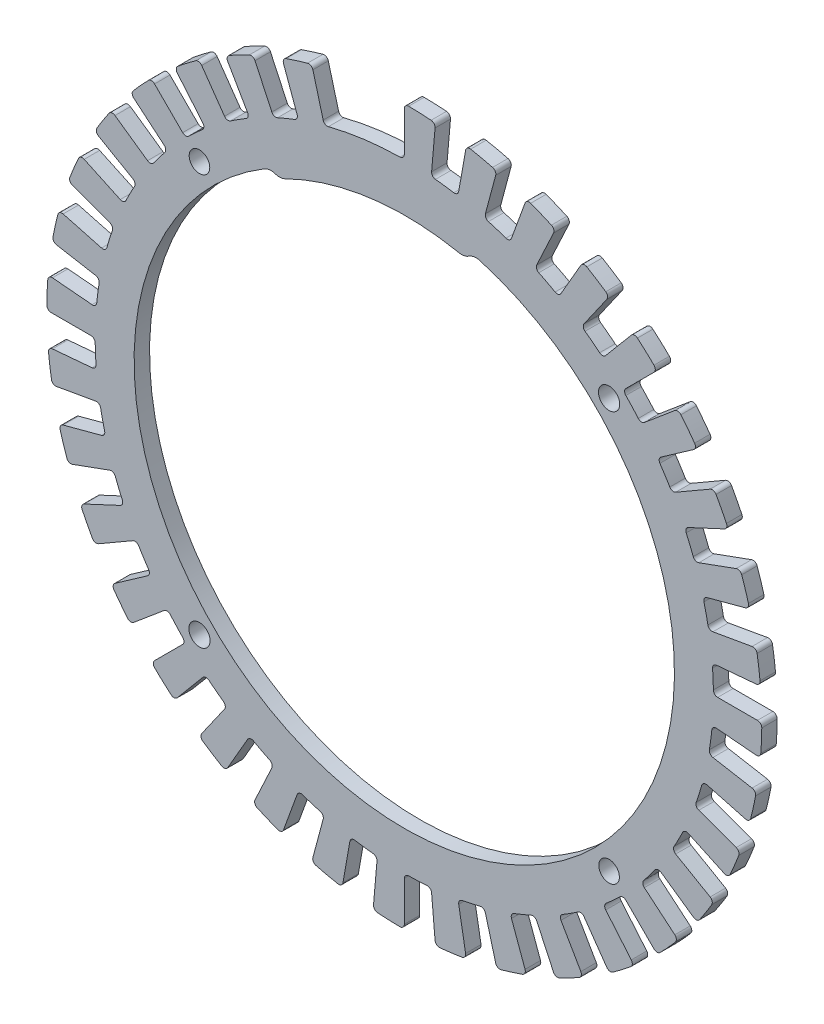
from build123d import *

# Parameters (mm, degrees)
SKETCH1_R           = 2.4585
SKETCH1_R_2         = 2.38125
BOSS_EXTRUDE1_DEPTH = 3.571875


with BuildPart() as part:
    # Sketch1 → Boss-Extrude1 (new body)
    with BuildSketch(Plane.XY):
        with BuildLine():
            Line((7.120090774, 81.383009943), (6.318190247, 72.217244977))
            ThreePointArc((6.318190247, 72.217244977), (6.543925597, 71.492600102), (7.213496876, 71.135191451))
            ThreePointArc((7.213496876, 71.135191451), (9.332622744, 70.888307588), (11.443439394, 70.578308954))
            ThreePointArc((11.443439394, 70.578308954), (12.182699751, 70.750241401), (12.58829525, 71.391769993))
            Line((12.58829525, 71.391769993), (14.185993357, 80.45276622))
            ThreePointArc((14.185993357, 80.45276622), (14.60224868, 81.101765071), (15.35649023, 81.261726586))
            ThreePointArc((15.35649023, 81.261726586), (17.899556073, 80.739679789), (20.424982959, 80.138068801))
            ThreePointArc((20.424982959, 80.138068801), (21.040955292, 79.674338181), (21.143931966, 78.910228368))
            Line((21.143931966, 78.910228368), (18.762595726, 70.022960532))
            ThreePointArc((18.762595726, 70.022960532), (18.859068387, 69.270126109), (19.456404014, 68.801877466))
            ThreePointArc((19.456404014, 68.801877466), (21.500464665, 68.190761978), (23.525382569, 67.518933456))
            ThreePointArc((23.525382569, 67.518933456), (24.283267656, 67.559882649), (24.794101519, 68.12123406))
            Line((24.794101519, 68.12123406), (27.940952485, 76.76713603))
            ThreePointArc((27.940952485, 76.76713603), (28.463581422, 77.333993152), (29.234141374, 77.360551822))
            ThreePointArc((29.234141374, 77.360551822), (31.647919857, 76.404837339), (34.030511182, 75.373830397))
            ThreePointArc((34.030511182, 75.373830397), (34.556599534, 74.810182414), (34.525325484, 74.039799434))
            Line((34.525325484, 74.039799434), (30.636909229, 65.701063864))
            ThreePointArc((30.636909229, 65.701063864), (30.601187928, 64.942914386), (31.108138161, 64.378053249))
            ThreePointArc((31.108138161, 64.378053249), (33.015025846, 63.421274572), (34.892518899, 62.40802933))
            ThreePointArc((34.892518899, 62.40802933), (35.646000762, 62.316751049), (36.24655156, 62.780868901))
            Line((36.24655156, 62.780868901), (40.84693991, 70.748975258))
            ThreePointArc((40.84693991, 70.748975258), (41.460062645, 71.216466984), (42.223527925, 71.108815836))
            ThreePointArc((42.223527925, 71.108815836), (44.43467761, 69.748472569), (46.602039543, 68.319396297))
            ThreePointArc((46.602039543, 68.319396297), (47.022258986, 67.67295711), (46.857684459, 66.91970866))
            Line((46.857684459, 66.91970866), (41.580335748, 59.382873618))
            ThreePointArc((41.580335748, 59.382873618), (41.413505858, 58.642445073), (41.814667271, 57.998134462))
            ThreePointArc((41.814667271, 57.998134462), (43.526442174, 56.724763831), (45.199463699, 55.400888814))
            ThreePointArc((45.199463699, 55.400888814), (45.925648172, 55.180156502), (46.597668473, 55.53293881))
            Line((46.597668473, 55.53293881), (52.511813735, 62.581142673))
            ThreePointArc((52.511813735, 62.581142673), (53.196800845, 62.935064503), (53.929973946, 62.696474464))
            ThreePointArc((53.929973946, 62.696474464), (55.87131017, 60.972835754), (57.757588515, 59.189111912))
            ThreePointArc((57.757588515, 59.189111912), (58.059170893, 58.479523249), (57.766296402, 57.766296402))
            Line((57.766296402, 57.766296402), (51.260364806, 51.260364806))
            ThreePointArc((51.260364806, 51.260364806), (50.967495369, 50.56015474), (51.250678875, 49.855971707))
            ThreePointArc((51.250678875, 49.855971707), (52.715329582, 48.304699845), (54.133045666, 46.710420325))
            ThreePointArc((54.133045666, 46.710420325), (54.809868002, 46.366940822), (55.53293881, 46.597668473))
            Line((55.53293881, 46.597668473), (62.581142673, 52.511813735))
            ThreePointArc((62.581142673, 52.511813735), (63.31718117, 52.741411935), (63.997784998, 52.379132441))
            ThreePointArc((63.997784998, 52.379132441), (65.610321242, 50.344570179), (67.158202386, 48.260396313))
            ThreePointArc((67.158202386, 48.260396313), (67.331984272, 47.509218665), (66.91970866, 46.857684459))
            Line((66.91970866, 46.857684459), (59.382873618, 41.580335748))
            ThreePointArc((59.382873618, 41.580335748), (58.972863325, 40.94161969), (59.129464536, 40.19896048))
            ThreePointArc((59.129464536, 40.19896048), (60.302488376, 38.416921997), (61.421822434, 36.600679351))
            ThreePointArc((61.421822434, 36.600679351), (62.028717727, 36.144889108), (62.780868901, 36.24655156))
            Line((62.780868901, 36.24655156), (70.748975258, 40.84693991))
            ThreePointArc((70.748975258, 40.84693991), (71.513700985, 40.945238253), (72.121055738, 40.470276985))
            ThreePointArc((72.121055738, 40.470276985), (73.355795904, 38.186610315), (74.518248261, 35.865312993))
            ThreePointArc((74.518248261, 35.865312993), (74.55894938, 35.095370514), (74.039799434, 34.525325484))
            Line((74.039799434, 34.525325484), (65.701063864, 30.636909229))
            ThreePointArc((65.701063864, 30.636909229), (65.186370669, 30.079094244), (65.211631338, 29.320524181))
            ThreePointArc((65.211631338, 29.320524181), (66.057386575, 27.361865414), (66.844328207, 25.378845255))
            ThreePointArc((66.844328207, 25.378845255), (67.362856253, 24.824593229), (68.12123406, 24.794101519))
            Line((68.12123406, 24.794101519), (76.76713603, 27.940952485))
            ThreePointArc((76.76713603, 27.940952485), (77.537313183, 27.904964226), (78.052964694, 27.331752641))
            ThreePointArc((78.052964694, 27.331752641), (78.872391827, 24.868369619), (79.614094871, 22.380480286))
            ThreePointArc((79.614094871, 22.380480286), (79.52047854, 21.615167288), (78.910228368, 21.143931966))
            Line((78.910228368, 21.143931966), (70.022960532, 18.762595726))
            ThreePointArc((70.022960532, 18.762595726), (69.419223127, 18.30263074), (69.312375721, 17.551198591))
            ThreePointArc((69.312375721, 17.551198591), (69.805164509, 15.475432397), (70.235802893, 13.385887789))
            ThreePointArc((70.235802893, 13.385887789), (70.650208479, 12.750014647), (71.391769993, 12.58829525))
            Line((71.391769993, 12.58829525), (80.45276622, 14.185993357))
            ThreePointArc((80.45276622, 14.185993357), (81.204993357, 14.016811982), (81.613273815, 13.362766823))
            ThreePointArc((81.613273815, 13.362766823), (81.992490036, 10.794516097), (82.290907495, 8.215628011))
            ThreePointArc((82.290907495, 8.215628011), (82.065818199, 7.478198142), (81.383009943, 7.120090774))
            Line((81.383009943, 7.120090774), (72.217244977, 6.318190247))
            ThreePointArc((72.217244977, 6.318190247), (71.542807618, 5.970051062), (71.30709864, 5.248588713))
            ThreePointArc((71.30709864, 5.248588713), (71.431947843, 3.118786197), (71.49319825, 0.986206897))
            ThreePointArc((71.49319825, 0.986206897), (71.79088987, 0.288033321), (72.49310312, 0))
            Line((72.49310312, 0), (81.69387982, 0))
            ThreePointArc((81.69387982, 0), (82.405300898, -0.297234001), (82.693804909, -1.012239902))
            ThreePointArc((82.693804909, -1.012239902), (82.621287925, -3.607323335), (82.467352536, -6.198851964))
            ThreePointArc((82.467352536, -6.198851964), (82.1176295, -6.88599227), (81.383009943, -7.120090774))
            Line((81.383009943, -7.120090774), (72.217244977, -6.318190247))
            ThreePointArc((72.217244977, -6.318190247), (71.492600102, -6.543925597), (71.135191451, -7.213496876))
            ThreePointArc((71.135191451, -7.213496876), (70.888307588, -9.332622744), (70.578308954, -11.443439394))
            ThreePointArc((70.578308954, -11.443439394), (70.750241401, -12.182699751), (71.391769993, -12.58829525))
            Line((71.391769993, -12.58829525), (80.45276622, -14.185993357))
            ThreePointArc((80.45276622, -14.185993357), (81.101765071, -14.60224868), (81.261726586, -15.35649023))
            ThreePointArc((81.261726586, -15.35649023), (80.739679789, -17.899556073), (80.138068801, -20.424982959))
            ThreePointArc((80.138068801, -20.424982959), (79.674338181, -21.040955292), (78.910228368, -21.143931966))
            Line((78.910228368, -21.143931966), (70.022960532, -18.762595726))
            ThreePointArc((70.022960532, -18.762595726), (69.270126109, -18.859068387), (68.801877466, -19.456404014))
            ThreePointArc((68.801877466, -19.456404014), (68.190761979, -21.500464665), (67.518933456, -23.525382569))
            ThreePointArc((67.518933456, -23.525382569), (67.559882649, -24.283267656), (68.12123406, -24.794101519))
            Line((68.12123406, -24.794101519), (76.76713603, -27.940952485))
            ThreePointArc((76.76713603, -27.940952485), (77.333993152, -28.463581422), (77.360551822, -29.234141374))
            ThreePointArc((77.360551822, -29.234141374), (76.404837339, -31.647919857), (75.373830397, -34.030511182))
            ThreePointArc((75.373830397, -34.030511182), (74.810182414, -34.556599534), (74.039799434, -34.525325484))
            Line((74.039799434, -34.525325484), (65.701063864, -30.636909229))
            ThreePointArc((65.701063864, -30.636909229), (64.942914386, -30.601187928), (64.378053249, -31.10813816))
            ThreePointArc((64.378053249, -31.10813816), (63.421274572, -33.015025846), (62.40802933, -34.892518899))
            ThreePointArc((62.40802933, -34.892518899), (62.316751049, -35.646000762), (62.780868901, -36.24655156))
            Line((62.780868901, -36.24655156), (70.748975258, -40.84693991))
            ThreePointArc((70.748975258, -40.84693991), (71.216466984, -41.460062645), (71.108815836, -42.223527925))
            ThreePointArc((71.108815836, -42.223527925), (69.748472569, -44.43467761), (68.319396297, -46.602039543))
            ThreePointArc((68.319396297, -46.602039543), (67.67295711, -47.022258986), (66.91970866, -46.857684459))
            Line((66.91970866, -46.857684459), (59.382873618, -41.580335748))
            ThreePointArc((59.382873618, -41.580335748), (58.642445073, -41.413505858), (57.998134462, -41.814667271))
            ThreePointArc((57.998134462, -41.814667271), (56.724763831, -43.526442174), (55.400888814, -45.199463699))
            ThreePointArc((55.400888814, -45.199463699), (55.180156502, -45.925648172), (55.53293881, -46.597668473))
            Line((55.53293881, -46.597668473), (62.581142673, -52.511813735))
            ThreePointArc((62.581142673, -52.511813735), (62.935064503, -53.196800845), (62.696474464, -53.929973946))
            ThreePointArc((62.696474464, -53.929973946), (60.972835754, -55.87131017), (59.189111912, -57.757588515))
            ThreePointArc((59.189111912, -57.757588515), (58.479523249, -58.059170893), (57.766296402, -57.766296402))
            Line((57.766296402, -57.766296402), (51.260364806, -51.260364806))
            ThreePointArc((51.260364806, -51.260364806), (50.56015474, -50.967495369), (49.855971707, -51.250678875))
            ThreePointArc((49.855971707, -51.250678875), (48.304699845, -52.715329582), (46.710420325, -54.133045666))
            ThreePointArc((46.710420325, -54.133045666), (46.366940822, -54.809868002), (46.597668473, -55.53293881))
            Line((46.597668473, -55.53293881), (52.511813735, -62.581142673))
            ThreePointArc((52.511813735, -62.581142673), (52.741411935, -63.31718117), (52.379132441, -63.997784998))
            ThreePointArc((52.379132441, -63.997784998), (50.344570179, -65.610321242), (48.260396313, -67.158202386))
            ThreePointArc((48.260396313, -67.158202386), (47.509218665, -67.331984272), (46.857684459, -66.91970866))
            Line((46.857684459, -66.91970866), (41.580335748, -59.382873618))
            ThreePointArc((41.580335748, -59.382873618), (40.94161969, -58.972863325), (40.19896048, -59.129464536))
            ThreePointArc((40.19896048, -59.129464536), (38.416921997, -60.302488376), (36.600679351, -61.421822434))
            ThreePointArc((36.600679351, -61.421822434), (36.144889108, -62.028717727), (36.24655156, -62.780868901))
            Line((36.24655156, -62.780868901), (40.84693991, -70.748975258))
            ThreePointArc((40.84693991, -70.748975258), (40.945238253, -71.513700985), (40.470276985, -72.121055738))
            ThreePointArc((40.470276985, -72.121055738), (38.186610315, -73.355795904), (35.865312993, -74.518248261))
            ThreePointArc((35.865312993, -74.518248261), (35.095370514, -74.55894938), (34.525325484, -74.039799434))
            Line((34.525325484, -74.039799434), (30.636909229, -65.701063864))
            ThreePointArc((30.636909229, -65.701063864), (30.079094244, -65.186370669), (29.320524181, -65.211631338))
            ThreePointArc((29.320524181, -65.211631338), (27.361865414, -66.057386575), (25.378845255, -66.844328207))
            ThreePointArc((25.378845255, -66.844328207), (24.824593229, -67.362856253), (24.794101519, -68.12123406))
            Line((24.794101519, -68.12123406), (27.940952485, -76.76713603))
            ThreePointArc((27.940952485, -76.76713603), (27.904964226, -77.537313183), (27.331752641, -78.052964694))
            ThreePointArc((27.331752641, -78.052964694), (24.868369619, -78.872391827), (22.380480286, -79.614094871))
            ThreePointArc((22.380480286, -79.614094871), (21.615167288, -79.52047854), (21.143931966, -78.910228368))
            Line((21.143931966, -78.910228368), (18.762595726, -70.022960532))
            ThreePointArc((18.762595726, -70.022960532), (18.30263074, -69.419223127), (17.551198591, -69.312375721))
            ThreePointArc((17.551198591, -69.312375721), (15.475432397, -69.805164509), (13.385887789, -70.235802893))
            ThreePointArc((13.385887789, -70.235802893), (12.750014647, -70.650208479), (12.58829525, -71.391769993))
            Line((12.58829525, -71.391769993), (14.185993357, -80.45276622))
            ThreePointArc((14.185993357, -80.45276622), (14.016811982, -81.204993357), (13.362766823, -81.613273815))
            ThreePointArc((13.362766823, -81.613273815), (10.794516097, -81.992490036), (8.215628011, -82.290907495))
            ThreePointArc((8.215628011, -82.290907495), (7.478198142, -82.065818199), (7.120090774, -81.383009943))
            Line((7.120090774, -81.383009943), (6.318190247, -72.217244977))
            ThreePointArc((6.318190247, -72.217244977), (5.970051062, -71.542807618), (5.248588713, -71.30709864))
            ThreePointArc((5.248588713, -71.30709864), (3.118786197, -71.431947843), (0.986206897, -71.49319825))
            ThreePointArc((0.986206897, -71.49319825), (0.288033321, -71.79088987), (0, -72.49310312))
            Line((0, -72.49310312), (0, -81.69387982))
            ThreePointArc((0, -81.69387982), (-0.297234001, -82.405300898), (-1.012239902, -82.693804909))
            ThreePointArc((-1.012239902, -82.693804909), (-3.607323335, -82.621287925), (-6.198851964, -82.467352536))
            ThreePointArc((-6.198851964, -82.467352536), (-6.88599227, -82.1176295), (-7.120090774, -81.383009943))
            Line((-7.120090774, -81.383009943), (-6.318190247, -72.217244977))
            ThreePointArc((-6.318190247, -72.217244977), (-6.543925597, -71.492600102), (-7.213496876, -71.135191451))
            ThreePointArc((-7.213496876, -71.135191451), (-9.332622744, -70.888307588), (-11.443439394, -70.578308954))
            ThreePointArc((-11.443439394, -70.578308954), (-12.182699751, -70.750241401), (-12.58829525, -71.391769993))
            Line((-12.58829525, -71.391769993), (-14.185993357, -80.45276622))
            ThreePointArc((-14.185993357, -80.45276622), (-14.60224868, -81.101765071), (-15.35649023, -81.261726586))
            ThreePointArc((-15.35649023, -81.261726586), (-17.899556073, -80.739679789), (-20.424982959, -80.138068801))
            ThreePointArc((-20.424982959, -80.138068801), (-21.040955292, -79.674338181), (-21.143931966, -78.910228368))
            Line((-21.143931966, -78.910228368), (-18.762595726, -70.022960532))
            ThreePointArc((-18.762595726, -70.022960532), (-18.859068387, -69.270126109), (-19.456404014, -68.801877466))
            ThreePointArc((-19.456404014, -68.801877466), (-21.500464665, -68.190761979), (-23.525382569, -67.518933456))
            ThreePointArc((-23.525382569, -67.518933456), (-24.283267656, -67.559882649), (-24.794101519, -68.12123406))
            Line((-24.794101519, -68.12123406), (-27.940952485, -76.76713603))
            ThreePointArc((-27.940952485, -76.76713603), (-28.463581422, -77.333993152), (-29.234141374, -77.360551822))
            ThreePointArc((-29.234141374, -77.360551822), (-31.647919857, -76.404837339), (-34.030511182, -75.373830397))
            ThreePointArc((-34.030511182, -75.373830397), (-34.556599534, -74.810182414), (-34.525325484, -74.039799434))
            Line((-34.525325484, -74.039799434), (-30.636909229, -65.701063864))
            ThreePointArc((-30.636909229, -65.701063864), (-30.601187928, -64.942914386), (-31.10813816, -64.378053249))
            ThreePointArc((-31.10813816, -64.378053249), (-33.015025846, -63.421274572), (-34.892518899, -62.40802933))
            ThreePointArc((-34.892518899, -62.40802933), (-35.646000762, -62.316751049), (-36.24655156, -62.780868901))
            Line((-36.24655156, -62.780868901), (-40.84693991, -70.748975258))
            ThreePointArc((-40.84693991, -70.748975258), (-41.460062645, -71.216466984), (-42.223527925, -71.108815836))
            ThreePointArc((-42.223527925, -71.108815836), (-44.43467761, -69.748472569), (-46.602039543, -68.319396297))
            ThreePointArc((-46.602039543, -68.319396297), (-47.022258986, -67.67295711), (-46.857684459, -66.91970866))
            Line((-46.857684459, -66.91970866), (-41.580335748, -59.382873618))
            ThreePointArc((-41.580335748, -59.382873618), (-41.413505858, -58.642445073), (-41.814667271, -57.998134462))
            ThreePointArc((-41.814667271, -57.998134462), (-43.526442174, -56.724763831), (-45.199463699, -55.400888814))
            ThreePointArc((-45.199463699, -55.400888814), (-45.925648172, -55.180156502), (-46.597668473, -55.53293881))
            Line((-46.597668473, -55.53293881), (-52.511813735, -62.581142673))
            ThreePointArc((-52.511813735, -62.581142673), (-53.196800845, -62.935064504), (-53.929973946, -62.696474464))
            ThreePointArc((-53.929973946, -62.696474464), (-55.87131017, -60.972835754), (-57.757588515, -59.189111912))
            ThreePointArc((-57.757588515, -59.189111912), (-58.059170893, -58.479523249), (-57.766296402, -57.766296402))
            Line((-57.766296402, -57.766296402), (-51.260364806, -51.260364806))
            ThreePointArc((-51.260364806, -51.260364806), (-50.967495369, -50.56015474), (-51.250678875, -49.855971707))
            ThreePointArc((-51.250678875, -49.855971707), (-52.715329582, -48.304699845), (-54.133045666, -46.710420325))
            ThreePointArc((-54.133045666, -46.710420325), (-54.809868002, -46.366940822), (-55.53293881, -46.597668473))
            Line((-55.53293881, -46.597668473), (-62.581142673, -52.511813735))
            ThreePointArc((-62.581142673, -52.511813735), (-63.31718117, -52.741411935), (-63.997784998, -52.379132441))
            ThreePointArc((-63.997784998, -52.379132441), (-65.610321242, -50.344570179), (-67.158202386, -48.260396313))
            ThreePointArc((-67.158202386, -48.260396313), (-67.331984272, -47.509218665), (-66.91970866, -46.857684459))
            Line((-66.91970866, -46.857684459), (-59.382873618, -41.580335748))
            ThreePointArc((-59.382873618, -41.580335748), (-58.972863325, -40.94161969), (-59.129464536, -40.19896048))
            ThreePointArc((-59.129464536, -40.19896048), (-60.302488376, -38.416921997), (-61.421822434, -36.600679351))
            ThreePointArc((-61.421822434, -36.600679351), (-62.028717727, -36.144889108), (-62.780868901, -36.24655156))
            Line((-62.780868901, -36.24655156), (-70.748975258, -40.84693991))
            ThreePointArc((-70.748975258, -40.84693991), (-71.513700985, -40.945238253), (-72.121055738, -40.470276985))
            ThreePointArc((-72.121055738, -40.470276985), (-73.355795904, -38.186610315), (-74.518248261, -35.865312993))
            ThreePointArc((-74.518248261, -35.865312993), (-74.55894938, -35.095370514), (-74.039799434, -34.525325484))
            Line((-74.039799434, -34.525325484), (-65.701063864, -30.636909229))
            ThreePointArc((-65.701063864, -30.636909229), (-65.186370669, -30.079094244), (-65.211631338, -29.320524181))
            ThreePointArc((-65.211631338, -29.320524181), (-66.057386575, -27.361865414), (-66.844328207, -25.378845255))
            ThreePointArc((-66.844328207, -25.378845255), (-67.362856253, -24.824593229), (-68.12123406, -24.794101519))
            Line((-68.12123406, -24.794101519), (-76.76713603, -27.940952485))
            ThreePointArc((-76.76713603, -27.940952485), (-77.537313183, -27.904964226), (-78.052964694, -27.331752641))
            ThreePointArc((-78.052964694, -27.331752641), (-78.872391827, -24.868369619), (-79.614094871, -22.380480286))
            ThreePointArc((-79.614094871, -22.380480286), (-79.52047854, -21.615167288), (-78.910228368, -21.143931966))
            Line((-78.910228368, -21.143931966), (-70.022960532, -18.762595726))
            ThreePointArc((-70.022960532, -18.762595726), (-69.419223127, -18.30263074), (-69.312375721, -17.551198591))
            ThreePointArc((-69.312375721, -17.551198591), (-69.805164509, -15.475432397), (-70.235802893, -13.385887789))
            ThreePointArc((-70.235802893, -13.385887789), (-70.650208479, -12.750014647), (-71.391769993, -12.58829525))
            Line((-71.391769993, -12.58829525), (-80.45276622, -14.185993357))
            ThreePointArc((-80.45276622, -14.185993357), (-81.204993357, -14.016811982), (-81.613273815, -13.362766823))
            ThreePointArc((-81.613273815, -13.362766823), (-81.992490036, -10.794516097), (-82.290907495, -8.215628011))
            ThreePointArc((-82.290907495, -8.215628011), (-82.065818199, -7.478198142), (-81.383009943, -7.120090774))
            Line((-81.383009943, -7.120090774), (-72.217244977, -6.318190247))
            ThreePointArc((-72.217244977, -6.318190247), (-71.542807618, -5.970051062), (-71.30709864, -5.248588713))
            ThreePointArc((-71.30709864, -5.248588713), (-71.431947843, -3.118786197), (-71.49319825, -0.986206897))
            ThreePointArc((-71.49319825, -0.986206897), (-71.79088987, -0.288033321), (-72.49310312, 0))
            Line((-72.49310312, 0), (-81.69387982, 0))
            ThreePointArc((-81.69387982, 0), (-82.405300898, 0.297234001), (-82.693804909, 1.012239902))
            ThreePointArc((-82.693804909, 1.012239902), (-82.621287925, 3.607323335), (-82.467352536, 6.198851964))
            ThreePointArc((-82.467352536, 6.198851964), (-82.1176295, 6.88599227), (-81.383009943, 7.120090774))
            Line((-81.383009943, 7.120090774), (-72.217244977, 6.318190247))
            ThreePointArc((-72.217244977, 6.318190247), (-71.492600102, 6.543925597), (-71.135191451, 7.213496876))
            ThreePointArc((-71.135191451, 7.213496876), (-70.888307588, 9.332622744), (-70.578308954, 11.443439394))
            ThreePointArc((-70.578308954, 11.443439394), (-70.750241401, 12.182699751), (-71.391769993, 12.58829525))
            Line((-71.391769993, 12.58829525), (-80.45276622, 14.185993357))
            ThreePointArc((-80.45276622, 14.185993357), (-81.101765071, 14.60224868), (-81.261726586, 15.35649023))
            ThreePointArc((-81.261726586, 15.35649023), (-80.739679789, 17.899556073), (-80.138068801, 20.424982959))
            ThreePointArc((-80.138068801, 20.424982959), (-79.674338181, 21.040955292), (-78.910228368, 21.143931966))
            Line((-78.910228368, 21.143931966), (-70.022960532, 18.762595726))
            ThreePointArc((-70.022960532, 18.762595726), (-69.270126109, 18.859068387), (-68.801877466, 19.456404014))
            ThreePointArc((-68.801877466, 19.456404014), (-68.190761979, 21.500464665), (-67.518933456, 23.525382569))
            ThreePointArc((-67.518933456, 23.525382569), (-67.559882649, 24.283267656), (-68.12123406, 24.794101519))
            Line((-68.12123406, 24.794101519), (-76.76713603, 27.940952485))
            ThreePointArc((-76.76713603, 27.940952485), (-77.333993152, 28.463581422), (-77.360551822, 29.234141374))
            ThreePointArc((-77.360551822, 29.234141374), (-76.404837339, 31.647919857), (-75.373830397, 34.030511182))
            ThreePointArc((-75.373830397, 34.030511182), (-74.810182414, 34.556599534), (-74.039799434, 34.525325484))
            Line((-74.039799434, 34.525325484), (-65.701063864, 30.636909229))
            ThreePointArc((-65.701063864, 30.636909229), (-64.942914386, 30.601187928), (-64.378053249, 31.10813816))
            ThreePointArc((-64.378053249, 31.10813816), (-63.421274572, 33.015025846), (-62.40802933, 34.892518899))
            ThreePointArc((-62.40802933, 34.892518899), (-62.316751049, 35.646000762), (-62.780868901, 36.24655156))
            Line((-62.780868901, 36.24655156), (-70.748975258, 40.84693991))
            ThreePointArc((-70.748975258, 40.84693991), (-71.216466984, 41.460062645), (-71.108815836, 42.223527925))
            ThreePointArc((-71.108815836, 42.223527925), (-69.748472569, 44.43467761), (-68.319396297, 46.602039543))
            ThreePointArc((-68.319396297, 46.602039543), (-67.67295711, 47.022258986), (-66.91970866, 46.857684459))
            Line((-66.91970866, 46.857684459), (-59.382873618, 41.580335748))
            ThreePointArc((-59.382873618, 41.580335748), (-58.642445073, 41.413505858), (-57.998134462, 41.814667271))
            ThreePointArc((-57.998134462, 41.814667271), (-56.724763831, 43.526442174), (-55.400888814, 45.199463699))
            ThreePointArc((-55.400888814, 45.199463699), (-55.180156502, 45.925648172), (-55.53293881, 46.597668473))
            Line((-55.53293881, 46.597668473), (-62.581142673, 52.511813735))
            ThreePointArc((-62.581142673, 52.511813735), (-62.935064504, 53.196800845), (-62.696474464, 53.929973946))
            ThreePointArc((-62.696474464, 53.929973946), (-60.972835754, 55.87131017), (-59.189111912, 57.757588515))
            ThreePointArc((-59.189111912, 57.757588515), (-58.479523249, 58.059170893), (-57.766296402, 57.766296402))
            Line((-57.766296402, 57.766296402), (-51.260364806, 51.260364806))
            ThreePointArc((-51.260364806, 51.260364806), (-50.56015474, 50.967495369), (-49.855971707, 51.250678875))
            ThreePointArc((-49.855971707, 51.250678875), (-48.304699845, 52.715329582), (-46.710420325, 54.133045666))
            ThreePointArc((-46.710420325, 54.133045666), (-46.366940822, 54.809868002), (-46.597668473, 55.53293881))
            Line((-46.597668473, 55.53293881), (-52.511813735, 62.581142673))
            ThreePointArc((-52.511813735, 62.581142673), (-52.741411935, 63.31718117), (-52.379132441, 63.997784998))
            ThreePointArc((-52.379132441, 63.997784998), (-50.344570179, 65.610321242), (-48.260396313, 67.158202386))
            ThreePointArc((-48.260396313, 67.158202386), (-47.509218665, 67.331984272), (-46.857684459, 66.91970866))
            Line((-46.857684459, 66.91970866), (-41.580335748, 59.382873618))
            ThreePointArc((-41.580335748, 59.382873618), (-40.94161969, 58.972863325), (-40.19896048, 59.129464536))
            ThreePointArc((-40.19896048, 59.129464536), (-38.416921997, 60.302488376), (-36.600679351, 61.421822434))
            ThreePointArc((-36.600679351, 61.421822434), (-36.144889108, 62.028717727), (-36.24655156, 62.780868901))
            Line((-36.24655156, 62.780868901), (-40.84693991, 70.748975258))
            ThreePointArc((-40.84693991, 70.748975258), (-40.945238253, 71.513700985), (-40.470276985, 72.121055738))
            ThreePointArc((-40.470276985, 72.121055738), (-38.186610315, 73.355795904), (-35.865312993, 74.518248261))
            ThreePointArc((-35.865312993, 74.518248261), (-35.095370514, 74.55894938), (-34.525325484, 74.039799434))
            Line((-34.525325484, 74.039799434), (-30.636909229, 65.701063864))
            ThreePointArc((-30.636909229, 65.701063864), (-30.079094244, 65.186370669), (-29.320524181, 65.211631338))
            ThreePointArc((-29.320524181, 65.211631338), (-27.361865414, 66.057386575), (-25.378845255, 66.844328207))
            ThreePointArc((-25.378845255, 66.844328207), (-24.824593229, 67.362856253), (-24.794101519, 68.12123406))
            Line((-24.794101519, 68.12123406), (-27.940952485, 76.76713603))
            ThreePointArc((-27.940952485, 76.76713603), (-27.904964226, 77.537313183), (-27.331752641, 78.052964694))
            ThreePointArc((-27.331752641, 78.052964694), (-24.868369619, 78.872391827), (-22.380480286, 79.614094871))
            ThreePointArc((-22.380480286, 79.614094871), (-21.615167288, 79.52047854), (-21.143931966, 78.910228368))
            Line((-21.143931966, 78.910228368), (-18.762595726, 70.022960532))
            ThreePointArc((-18.762595726, 70.022960532), (-18.30263074, 69.419223127), (-17.551198591, 69.312375721))
            ThreePointArc((-17.551198591, 69.312375721), (-15.475432397, 69.805164509), (-13.385887789, 70.235802893))
            ThreePointArc((-13.385887789, 70.235802893), (-7.213573177, 71.135183714), (-0.986360266, 71.493196134))
            ThreePointArc((-0.986360266, 71.493196134), (-0.288033321, 71.79088987), (0, 72.49310312))
            Line((0, 72.49310312), (0, 81.69387982))
            ThreePointArc((0, 81.69387982), (0.297234001, 82.405300898), (1.012239902, 82.693804909))
            ThreePointArc((1.012239902, 82.693804909), (3.607323335, 82.621287925), (6.198851964, 82.467352536))
            ThreePointArc((6.198851964, 82.467352536), (6.88599227, 82.1176295), (7.120090774, 81.383009943))
        make_face()
        with Locations((47.376154339, 47.376154339)):
            Circle(SKETCH1_R, mode=Mode.SUBTRACT)
        with Locations((-47.376154339, -47.376154339)):
            Circle(SKETCH1_R, mode=Mode.SUBTRACT)
        with Locations((47.376154339, -47.376154339)):
            Circle(SKETCH1_R_2, mode=Mode.SUBTRACT)
        with Locations((-47.376154339, 47.376154339)):
            Circle(SKETCH1_R_2, mode=Mode.SUBTRACT)
        with BuildLine():
            ThreePointArc((-32.399534916, 53.446423053), (8.157887014, -61.965303836), (17.462595357, 60.010897039))
            ThreePointArc((17.462595357, 60.010897039), (16.158723626, 60.09401264), (14.943172899, 59.61502817))
            ThreePointArc((14.943172899, 59.61502817), (13.835125402, 59.154945408), (12.635405963, 59.165839098))
            ThreePointArc((12.635405963, 59.165839098), (-7.879614623, 59.851615177), (-27.518110923, 53.879528313))
            ThreePointArc((-27.518110923, 53.879528313), (-28.674131419, 53.558495577), (-29.863501295, 53.716117604))
            ThreePointArc((-29.863501295, 53.716117604), (-31.161603438, 53.864173396), (-32.399534916, 53.446423053))
        make_face(mode=Mode.SUBTRACT)
    extrude(amount=BOSS_EXTRUDE1_DEPTH)


solid = part.part
